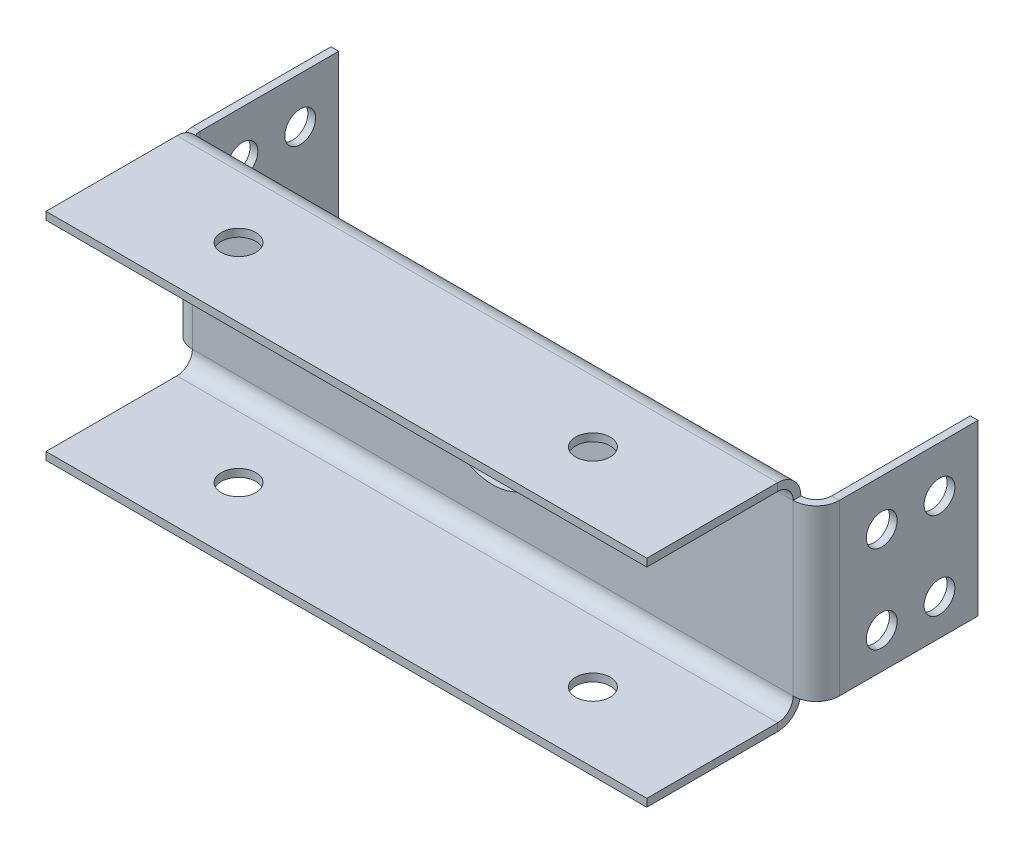
from build123d import *

# Parameters (mm, degrees)
BASE_FLANGE1_DEPTH      = 78
EDGE_FLANGE1_DEPTH      = 22
EDGE_FLANGE1_BEND_DEPTH = 22
SKETCH14_R              = 2.25
CUT_EXTRUDE1_DEPTH      = 33
SKETCH15_R              = 6.75
CUT_EXTRUDE2_DEPTH      = 85.599054368
CUT_EXTRUDE3_DEPTH      = 88.475710915
CUT_EXTRUDE3_DEPTH_BACK = 88.475710915
SKETCH16_R              = 2


# Sheet-metal steps are written as plain solids
with BuildPart() as part:
    # Sketch3 → Base-Flange1 (new body)
    with BuildSketch(Plane(origin=(0, 0, 0), x_dir=(0, 0, -1), z_dir=(1, 0, 0))):
        with BuildLine():
            Line((-20, 14), (-3, 14))
            ThreePointArc((-3, 14), (-0.878679656, 13.121320344), (0, 11))
            Line((0, 11), (0, -11))
            ThreePointArc((0, -11), (-0.878679656, -13.121320344), (-3, -14))
            Line((-3, -14), (-20, -14))
            Line((-20, -14), (-20, -13))
            Line((-20, -13), (-3, -13))
            ThreePointArc((-3, -13), (-1.585786438, -12.414213562), (-1, -11))
            Line((-1, -11), (-1, 11))
            ThreePointArc((-1, 11), (-1.585786438, 12.414213562), (-3, 13))
            Line((-3, 13), (-20, 13))
            Line((-20, 13), (-20, 14))
        make_face()
    extrude(amount=BASE_FLANGE1_DEPTH)

    # Edge-Flange1 section (across the edge) → Edge-Flange1 (add)
    with BuildSketch(Plane(origin=(80, 11, 0), x_dir=(-1, 0, 0), z_dir=(0, -1, 0))):
        with BuildLine():
            Line((-1, 2), (-1, 20))
            Line((-1, 20), (0, 20))
            Line((0, 20), (0, 2))
            ThreePointArc((0, 2), (0.585786438, 0.585786438), (2, 0))
            Line((2, 0), (2, -1))
            ThreePointArc((2, -1), (-0.121320344, -0.121320344), (-1, 2))
        make_face()
    extrude(amount=EDGE_FLANGE1_DEPTH)

    # Edge-Flange1 section 2 (across the edge) → Edge-Flange1 bend (add)
    with BuildSketch(Plane(origin=(-2, -11, 0), x_dir=(1, 0, 0), z_dir=(0, 1, 0))):
        with BuildLine():
            Line((-1, 2), (-1, 20))
            Line((-1, 20), (0, 20))
            Line((0, 20), (0, 2))
            ThreePointArc((0, 2), (0.585786438, 0.585786438), (2, 0))
            Line((2, 0), (2, -1))
            ThreePointArc((2, -1), (-0.121320344, -0.121320344), (-1, 2))
        make_face()
    extrude(amount=EDGE_FLANGE1_BEND_DEPTH)

    # Sketch14 → Cut-Extrude1 (cut)
    with BuildSketch(Plane(origin=(0, 14, 0), x_dir=(1, 0, 0), z_dir=(0, 1, 0))):
        with Locations(Location((16, -11, 0), (0, 0, 270))):
            Circle(SKETCH14_R)
        with Locations(Location((62, -11, 0), (0, 0, 270))):
            Circle(SKETCH14_R)
    extrude(amount=-CUT_EXTRUDE1_DEPTH, mode=Mode.SUBTRACT)

    # Sketch15 → Cut-Extrude2 (cut, through all)
    with BuildSketch(Plane(origin=(0, 0, 0), x_dir=(-1, 0, 0), z_dir=(0, 0, -1))):
        with Locations((-39, 0)):
            Circle(SKETCH15_R)
    extrude(amount=-CUT_EXTRUDE2_DEPTH, mode=Mode.SUBTRACT)

    # Sketch16 → Cut-Extrude3 (cut, two sides: drawn at the far end of the back side and taken through both)
    with BuildSketch(Plane.ZY.offset(3).offset(-CUT_EXTRUDE3_DEPTH_BACK)):
        with Locations((-15, 5)):
            Circle(SKETCH16_R)
        with Locations((-7.5, 5)):
            Circle(SKETCH16_R)
        with Locations((-7.5, -6.338473389)):
            Circle(SKETCH16_R)
        with Locations((-15, -6.338473389)):
            Circle(SKETCH16_R)
    extrude(amount=CUT_EXTRUDE3_DEPTH + CUT_EXTRUDE3_DEPTH_BACK, mode=Mode.SUBTRACT)


solid = part.part
